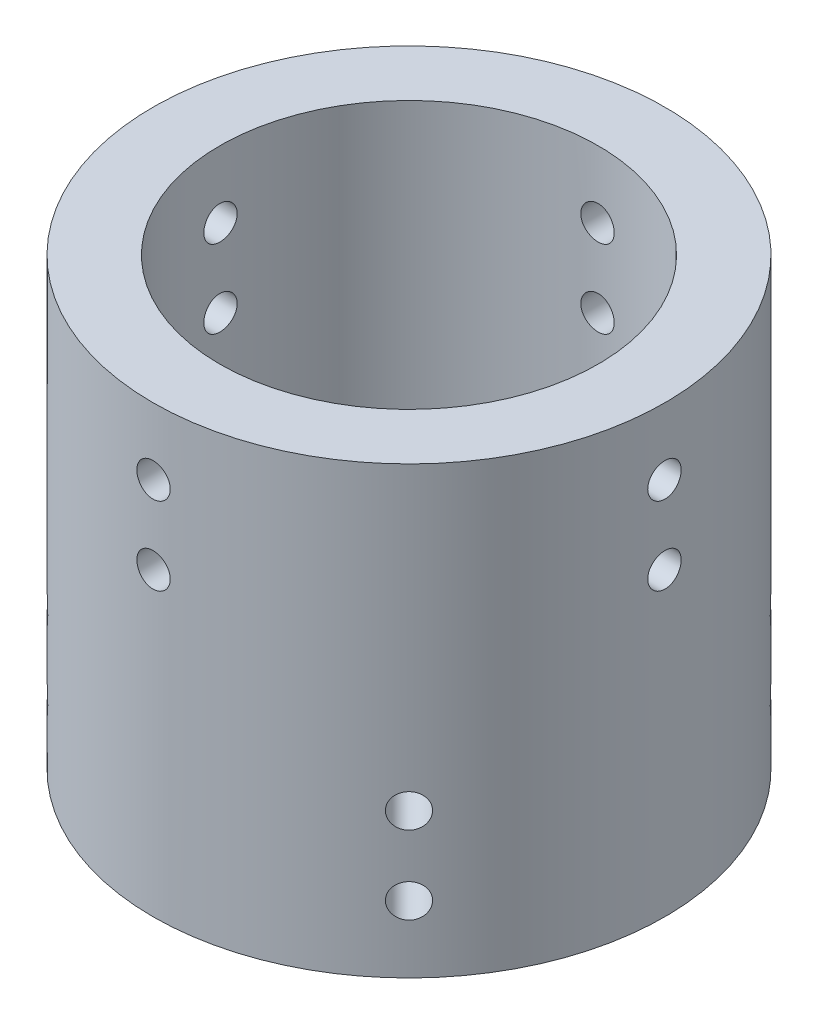
from build123d import *

# Parameters (mm, degrees)
SKETCH_1_R               = 23
EXTRUDE_1_DEPTH          = 10
SKETCH_2_R               = 23
SKETCH_2_R_2             = 17
EXTRUDE_2_DEPTH          = 30
SKETCH_3_R               = 1.5
CUT_EXTRUDE_1_DEPTH      = 52.555795019
SKETCH_4_R               = 1.5
CUT_EXTRUDE_2_DEPTH      = 52.555795187
PATTERN_CIRCULAR_1_COUNT = 4


with BuildPart() as part:
    # Эскиз1 → Бобышка-Вытянуть1 (new body)
    with BuildSketch(Plane(origin=(0, 0, 0), x_dir=(1, 0, 0), z_dir=(0, 1, 0))):
        Circle(SKETCH_1_R)
    extrude(amount=EXTRUDE_1_DEPTH)

    # Эскиз2 → Бобышка-Вытянуть2 (add)
    with BuildSketch(Plane(origin=(0, 10, 0), x_dir=(1, 0, 0), z_dir=(0, 1, 0))):
        Circle(SKETCH_2_R)
        Circle(SKETCH_2_R_2, mode=Mode.SUBTRACT)
    extrude(amount=EXTRUDE_2_DEPTH)

    # Эскиз3 → Вырез-Вытянуть1 (cut, through all)
    with BuildSketch(Plane(origin=(0, 0, 0), x_dir=(0, 0, -1), z_dir=(1, 0, 0))):
        with Locations((0, 27)):
            Circle(SKETCH_3_R)
        with Locations((0, 34)):
            Circle(SKETCH_3_R)
    cut_extrude_1 = extrude(amount=-CUT_EXTRUDE_1_DEPTH, mode=Mode.SUBTRACT)

    # Эскиз4 → Вырез-Вытянуть2 (cut, through all)
    with BuildSketch(Plane(origin=(0, 0, 0), x_dir=(0, -1, 0), z_dir=(0.7071067811865464, 0, 0.7071067811865488))):
        with Locations((-13, 0)):
            Circle(SKETCH_4_R)
        with Locations((-6, 0)):
            Circle(SKETCH_4_R)
    cut_extrude_2 = extrude(amount=-CUT_EXTRUDE_2_DEPTH, mode=Mode.SUBTRACT)

    # Круговой массив1: Вырез-Вытянуть1, Вырез-Вытянуть2 ×4 about axis
    pattern_circular_1_axis = Axis((0, 10, 0), (0, -1, 0))
    add([cut_extrude_1.rotate(pattern_circular_1_axis, i * 360 / PATTERN_CIRCULAR_1_COUNT) for i in range(1, PATTERN_CIRCULAR_1_COUNT)], mode=Mode.SUBTRACT)
    add([cut_extrude_2.rotate(pattern_circular_1_axis, i * 360 / PATTERN_CIRCULAR_1_COUNT) for i in range(1, PATTERN_CIRCULAR_1_COUNT)], mode=Mode.SUBTRACT)


solid = part.part
